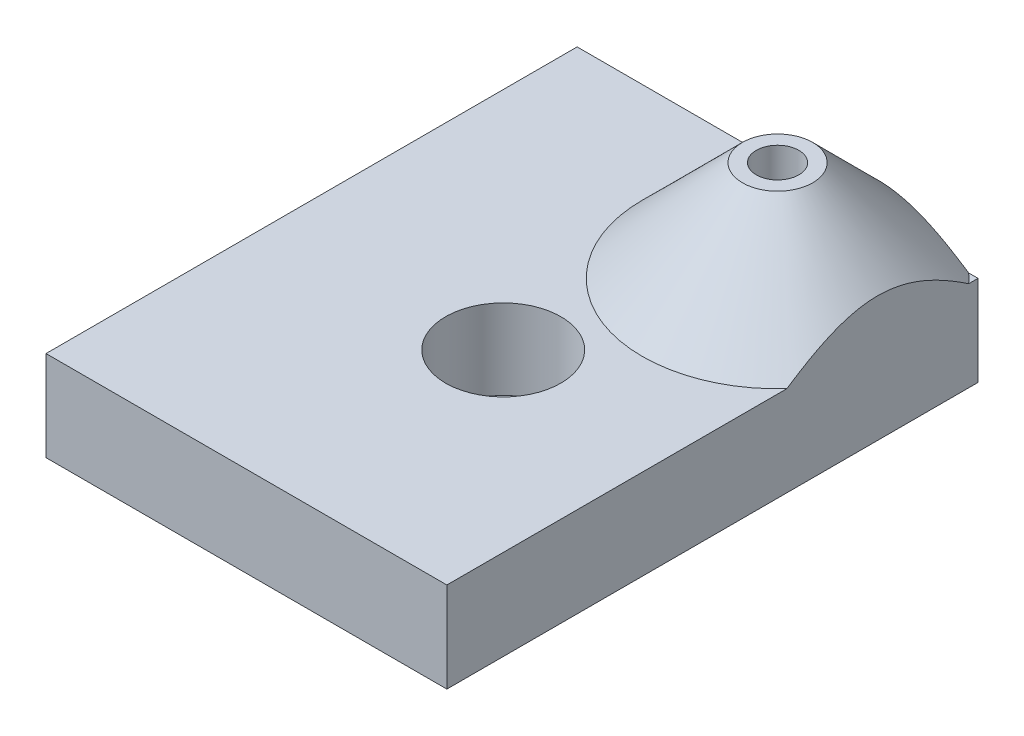
from build123d import *

# Parameters (mm, degrees)
SKETCH1_W               = 40
SKETCH1_H               = 48
BOSS_EXTRUDE1_DEPTH     = 9
CUT_EXTRUDE1_DEPTH      = 33.511536414
CUT_EXTRUDE1_DEPTH_BACK = 33.511536414
SKETCH2_R               = 2.625
SKETCH3_R               = 5.75
CUT_EXTRUDE2_DEPTH      = 8
SKETCH5_R               = 3.5
BOSS_EXTRUDE2_DEPTH     = 10
SKETCH6_W               = 40
SKETCH6_H               = 9
BOSS_EXTRUDE3_DEPTH     = 5
CHAMFER1_SIZE           = 10
CUT_EXTRUDE3_DEPTH      = 41.024992192
CUT_EXTRUDE3_DEPTH_BACK = 41.024992192
SKETCH7_R               = 2.125
CUT_EXTRUDE4_START      = -11
SKETCH8_W               = 4.75
SKETCH8_H               = 7.25
SKETCH8_R               = 2.125
CUT_EXTRUDE4_DEPTH      = 11


with BuildPart() as part:
    # Sketch1 → Boss-Extrude1 (new body)
    with BuildSketch(Plane(origin=(0, 0, 0), x_dir=(1, 0, 0), z_dir=(0, 1, 0))):
        Rectangle(SKETCH1_W, SKETCH1_H)
    extrude(amount=BOSS_EXTRUDE1_DEPTH)

    # Sketch2 → Cut-Extrude1 (cut, two sides: drawn at the far end of the back side and taken through both)
    with BuildSketch(Plane.XZ.offset(-CUT_EXTRUDE1_DEPTH_BACK)):
        with Locations(Location((2.5, 0.875, 0), (0, 0, 270))):
            Circle(SKETCH2_R)
    extrude(amount=CUT_EXTRUDE1_DEPTH + CUT_EXTRUDE1_DEPTH_BACK, mode=Mode.SUBTRACT)

    # Sketch3 → Cut-Extrude2 (cut)
    with BuildSketch(Plane(origin=(0, 9, 0), x_dir=(1, 0, 0), z_dir=(0, 1, 0))):
        with Locations(Location((2.5, -0.875, 0), (0, 0, 270))):
            Circle(SKETCH3_R)
    extrude(amount=-CUT_EXTRUDE2_DEPTH, mode=Mode.SUBTRACT)

    # Sketch5 → Boss-Extrude2 (add)
    with BuildSketch(Plane(origin=(0, 9, 0), x_dir=(1, 0, 0), z_dir=(0, 1, 0))):
        with Locations(Location((10, 19, 0), (0, 0, 90))):
            Circle(SKETCH5_R)
    extrude(amount=BOSS_EXTRUDE2_DEPTH)

    # Sketch6 → Boss-Extrude3 (add)
    with BuildSketch(Plane(origin=(0, 0, -24), x_dir=(-1, 0, 0), z_dir=(0, 0, -1))):
        with Locations((0, 4.5)):
            Rectangle(SKETCH6_W, SKETCH6_H)
    extrude(amount=BOSS_EXTRUDE3_DEPTH)

    # Chamfer1
    # the kernel refuses this chamfer: 10 mm, written as the material it adds along each edge
    with BuildSketch(Plane(origin=(10, 9, -19), x_dir=(0, 0, -1), z_dir=(1, 0, 0))) as chamfer1_piece_1_section:
        Polygon((3.5 + CHAMFER1_SIZE, 0), (3.5, CHAMFER1_SIZE), (3.5, 0), align=None)
    chamfer1_piece_1 = revolve(axis=Axis((10, 9, -19), (0, 1, 0)), mode=Mode.PRIVATE)
    chamfer1_piece_1 = split(chamfer1_piece_1, bisect_by=Plane(origin=(20, 13.766694853, -10.450462434), z_dir=(-1, 0, 0)), keep=Keep.TOP, mode=Mode.PRIVATE)
    chamfer1_piece_1 = split(chamfer1_piece_1, bisect_by=Plane(origin=(10, 13.766694853, -29), z_dir=(0, 0, 1)), keep=Keep.TOP, mode=Mode.PRIVATE)
    chamfer1_piece_1 = split(chamfer1_piece_1, bisect_by=Plane(origin=(10, 19, -10.450462434), z_dir=(0, -1, 0)), keep=Keep.TOP, mode=Mode.PRIVATE)
    add(chamfer1_piece_1)

    # Sketch7 → Cut-Extrude3 (cut, two sides: drawn at the far end of the back side and taken through both)
    with BuildSketch(Plane(origin=(0, 19, 0), x_dir=(1, 0, 0), z_dir=(0, 1, 0)).offset(-CUT_EXTRUDE3_DEPTH_BACK)):
        with Locations(Location((10, 19, 0), (0, 0, 270))):
            Circle(SKETCH7_R)
    extrude(amount=CUT_EXTRUDE3_DEPTH + CUT_EXTRUDE3_DEPTH_BACK, mode=Mode.SUBTRACT)

    # Sketch8 → Cut-Extrude4 (cut)
    # profile 1 of 3: a face of its own
    with BuildSketch(Plane.XZ.offset(CUT_EXTRUDE4_START)):
        with Locations((10, -19)):
            Rectangle(SKETCH8_W, SKETCH8_H)
        with Locations(Location((10, -19, 0), (0, 0, 90))):
            Circle(SKETCH8_R, mode=Mode.SUBTRACT)
    # profile 2 of 3: a face of its own
    with BuildSketch(Plane.XZ.offset(CUT_EXTRUDE4_START)):
        Polygon((7.625, -22.625), (7.625, -15.375), (5.532105274, -19), align=None)
    # profile 3 of 3: a face of its own
    with BuildSketch(Plane.XZ.offset(CUT_EXTRUDE4_START)):
        Polygon((14.467894726, -19), (12.375, -22.625), (12.375, -15.375), align=None)
    extrude(amount=CUT_EXTRUDE4_DEPTH, mode=Mode.SUBTRACT)


solid = part.part
